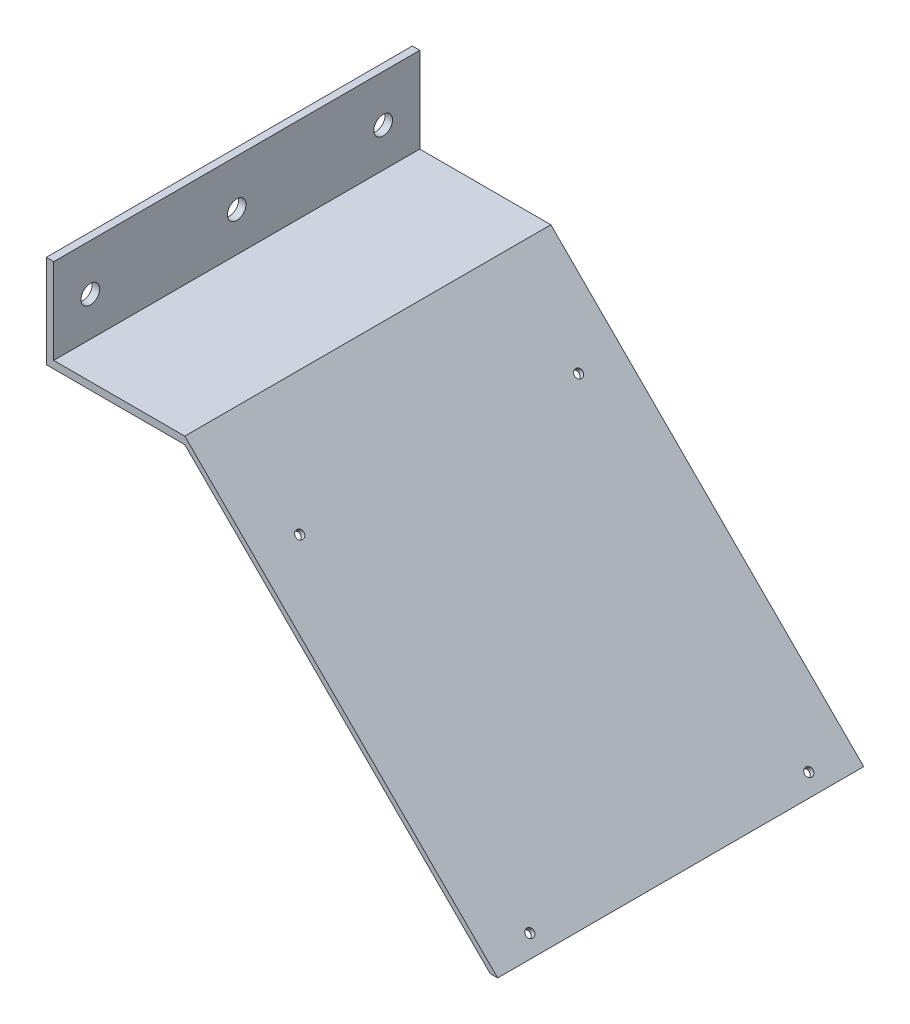
from build123d import *

# Parameters (mm, degrees)
BOSS_EXTRUDE1_DEPTH     = 100
CUT_EXTRUDE1_DEPTH      = 156.772779981
CUT_EXTRUDE1_DEPTH_BACK = 156.772779981
SKETCH2_R               = 1.13
F_4_40_TAPPED_HOLE1_D   = 2.2606
F_1_4_20_TAPPED_HOLE1_D = 5.1054


with BuildPart() as part:
    # Sketch1 → Boss-Extrude1 (new body)
    with BuildSketch(Plane.XY):
        Polygon((85.47060018, -83.43860018), (0, 2.032), (-35.81089, 2.032), (-35.81089, 25.4), (-37.84289, 25.4), (-37.84289, 0), (0, 0), (83.43860018, -83.43860018), align=None)
    extrude(amount=BOSS_EXTRUDE1_DEPTH)

    # Sketch2 → Cut-Extrude1 (cut, two sides: drawn at the far end of the back side and taken through both)
    with BuildSketch(Plane(origin=(1.016, 1.016, 0), x_dir=(0, 0, -1), z_dir=(0.7071067811865448, 0.7071067811865503, 0)).offset(-CUT_EXTRUDE1_DEPTH_BACK)):
        with Locations((-88.1, -26.136840979)):
            Circle(SKETCH2_R)
        with Locations((-11.9, -26.136840979)):
            Circle(SKETCH2_R)
        with Locations((-11.9, -115.036840979)):
            Circle(SKETCH2_R)
        with Locations((-88.1, -115.036840979)):
            Circle(SKETCH2_R)
    extrude(amount=CUT_EXTRUDE1_DEPTH + CUT_EXTRUDE1_DEPTH_BACK, mode=Mode.SUBTRACT)

    # #4-40 Tapped Hole1 (through all)
    with Locations(Plane(origin=(19.497537495, -17.465537495, 88.1), x_dir=(0.707106781187, -0.707106781187, 0), z_dir=(0.707106781187, 0.707106781187, 0))):
        with Locations((0, 0), (0, 76.2), (88.9, 76.2), (88.9, 0)):
            Hole(F_4_40_TAPPED_HOLE1_D / 2)

    # 1/4-20 Tapped Hole1 (through all)
    with Locations(Plane.ZY.offset(37.84289)):
        with Locations((10, 12.7), (50, 12.7), (90, 12.7)):
            Hole(F_1_4_20_TAPPED_HOLE1_D / 2)


solid = part.part
